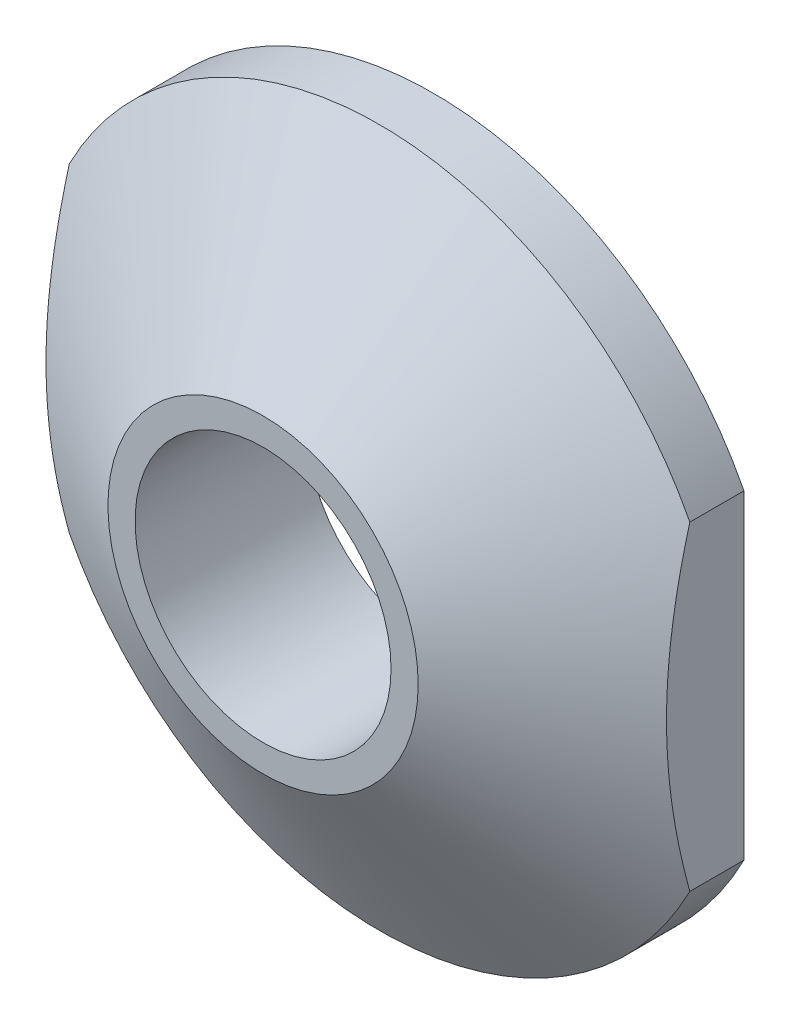
from build123d import *

# Parameters (mm, degrees)
SKETCH3_W          = 2.43419071
SKETCH3_H          = 7.16478775
CUT_EXTRUDE1_DEPTH = 7.733498348


with BuildPart() as part:
    # Sketch2 → Revolve1 (revolve)
    with BuildSketch(Plane(origin=(0, 0, 0), x_dir=(1, 0, 0), z_dir=(0, 1, 0))):
        Polygon((2, 0), (4.5, 1.502151548), (4.5, 2.2), (1.65, 2.2), (1.65, 0), align=None)
    revolve(axis=Axis((0, 0, 0), (0, 0, -1)))

    # Sketch3 → Cut-Extrude1 (cut, through all)
    with BuildSketch(Plane(origin=(0, 0, -2.2), x_dir=(-1, 0, 0), z_dir=(0, 0, -1))):
        with Locations((-5.217095355, -0.122475004)):
            Rectangle(SKETCH3_W, SKETCH3_H)
    cut_extrude1 = extrude(amount=-CUT_EXTRUDE1_DEPTH, mode=Mode.SUBTRACT)

    # Mirror1: Cut-Extrude1 across plane
    add(cut_extrude1.mirror(Plane(origin=(0, 0, 0), x_dir=(0, 0, 1), z_dir=(1, 0, 0))), mode=Mode.SUBTRACT)


solid = part.part
